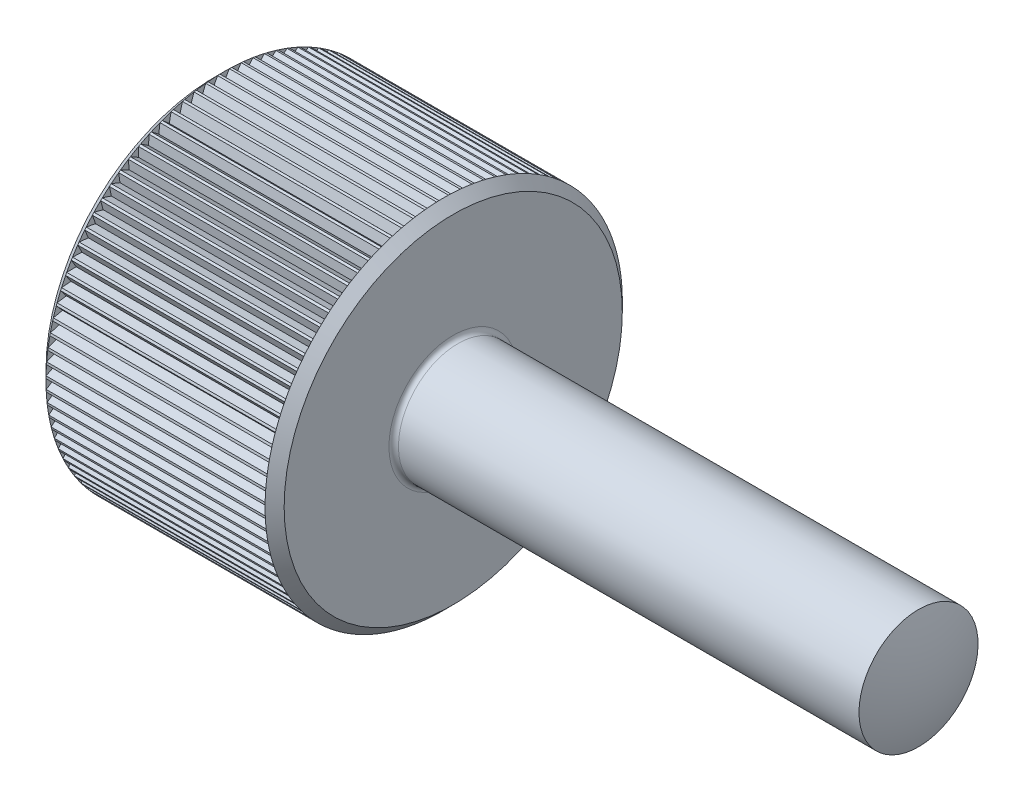
from build123d import *

# Parameters (mm, degrees)
CHAMFER1_SIZE           = 0.8
CUT_EXTRUDE1_DEPTH      = 18.4
CIRCULAR_PATTERN1_COUNT = 95
FILLET1_R               = 0.4


with BuildPart() as part:
    # Sketch1 → Base (revolve)
    with BuildSketch(Plane.XY):
        with BuildLine():
            Line((0, 0), (0, 15))
            Line((0, 15), (20, 15))
            Line((20, 15), (20, 5))
            Line((20, 5), (59.076696831, 5))
            ThreePointArc((59.076696831, 5), (59.767239295, 2.542267135), (60, 0))
            Line((60, 0), (0, 0))
        make_face()
    revolve(axis=Axis((-48.211075441, 0, 0), (1, 0, 0)))

    # Chamfer1
    chamfer1_edges = [part.edges().sort_by_distance(p)[0] for p in [
        (0, -15, 0),
        (20, -15, 0),
    ]]
    chamfer(chamfer1_edges, length=CHAMFER1_SIZE)

    # Sketch3 → Cut-Extrude1 (cut)
    with BuildSketch(Plane(origin=(19.2, 0, 0), x_dir=(0, 0, -1), z_dir=(1, 0, 0))):
        Polygon((0, 14.307179677), (0.6, 15.346410162), (-0.6, 15.346410162), align=None)
    cut_extrude1 = extrude(amount=-CUT_EXTRUDE1_DEPTH, mode=Mode.SUBTRACT)

    # Circular-Pattern1: Cut-Extrude1 ×95 about axis
    circular_pattern1_axis = Axis((-48.211075441, 0, 0), (1, 0, 0))
    for i in range(1, CIRCULAR_PATTERN1_COUNT):
        add(cut_extrude1.rotate(circular_pattern1_axis, i * 360 / CIRCULAR_PATTERN1_COUNT), mode=Mode.SUBTRACT)

    # Fillet1
    fillet1_edges = [part.edges().sort_by_distance(p)[0] for p in [
        (20, -5, 0),
    ]]
    fillet(fillet1_edges, radius=FILLET1_R)


solid = part.part
